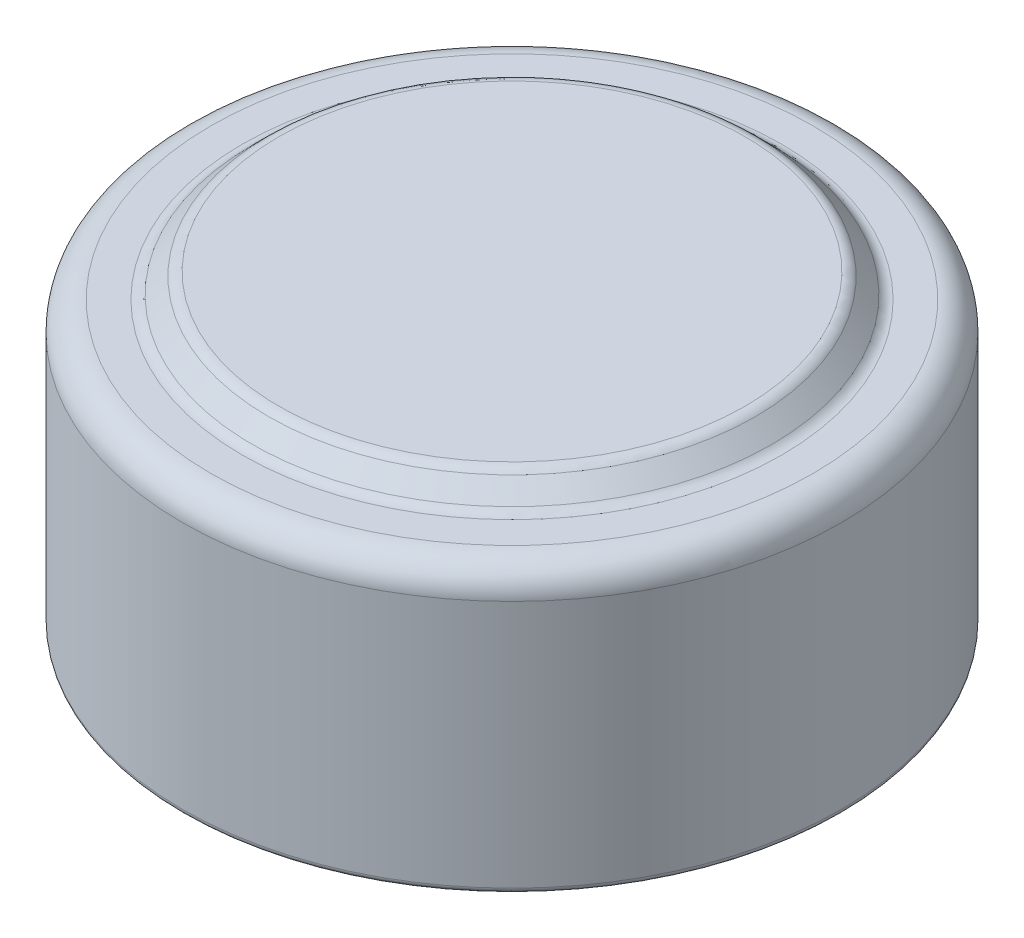
from build123d import *


with BuildPart() as part:
    # Sketch1 → Revolve1 (revolve)
    with BuildSketch(Plane.XY):
        with BuildLine():
            Line((0, 0), (-5.7, 0))
            ThreePointArc((-5.7, 0), (-5.770710678, 0.029289322), (-5.8, 0.1))
            Line((-5.8, 0.1), (-5.8, 4.47))
            ThreePointArc((-5.8, 4.47), (-5.653553391, 4.823553391), (-5.3, 4.97))
            Line((-5.3, 4.97), (-4.743553391, 4.97))
            ThreePointArc((-4.743553391, 4.97), (-4.647882533, 4.989030117), (-4.566776695, 5.043223305))
            Line((-4.566776695, 5.043223305), (-4.283223305, 5.326776695))
            ThreePointArc((-4.283223305, 5.326776695), (-4.202117467, 5.380969883), (-4.106446609, 5.4))
            Line((-4.106446609, 5.4), (0, 5.4))
            Line((0, 5.4), (0, 0))
        make_face()
    revolve(axis=Axis((0, 5.4, 0), (0, -1, 0)))


solid = part.part
